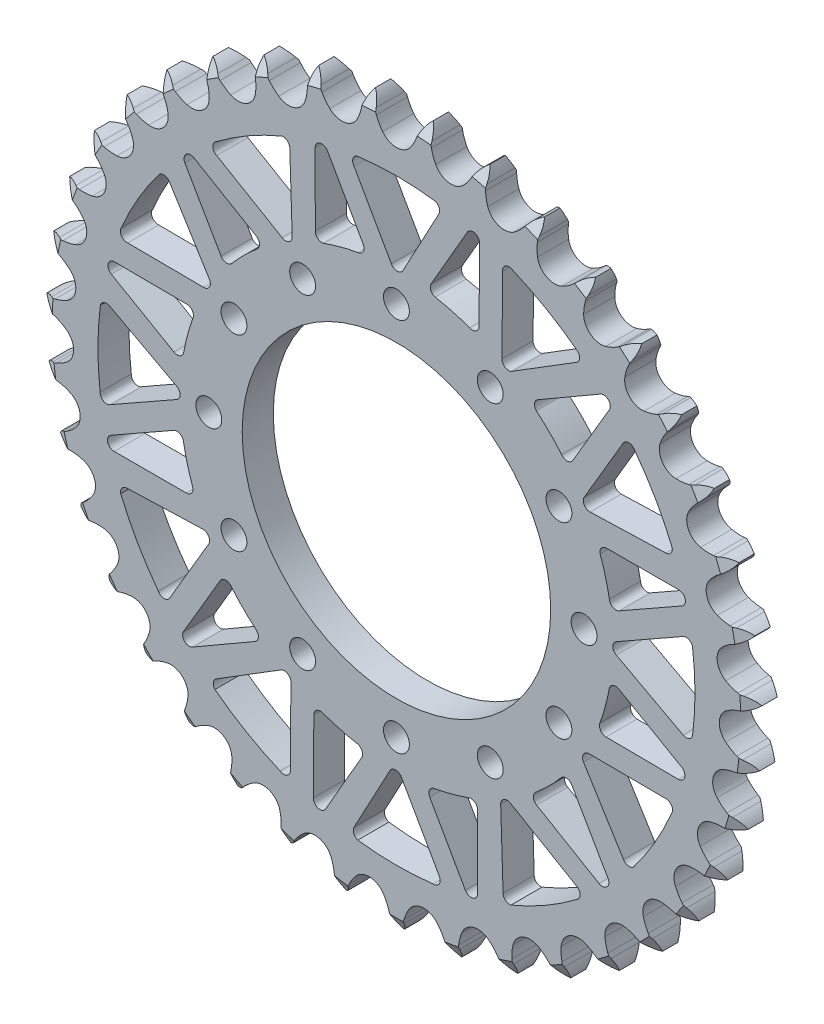
from build123d import *

# Parameters (mm, degrees)
EXTRUSION_DEPTH        = 7.2136
CUT_EXTRUDE_DEPTH      = 118.514389318
CUT_EXTRUDE_DEPTH_BACK = 118.514389318
SKETCH1_R              = 35.764294032
F_6_0MM_DOWEL_HOLE1_D  = 6
CIRPATTERN1_COUNT      = 12
CUT_EXTRUDE1_DEPTH     = 118.514389465
CIRPATTERN2_COUNT      = 12


with BuildPart() as part:
    # Teeth Sketch → Extrusion (new body)
    with BuildSketch(Plane.XY):
        with BuildLine():
            ThreePointArc((6.676484762, 82.703103732), (5.710873677, 81.555589606), (5.037571935, 80.215493266))
            Line((5.037571935, 80.215493266), (4.65053543, 79.150636707))
            ThreePointArc((4.65053543, 79.150636707), (4.030589042, 77.787636082), (3.22092759, 76.5280518))
            ThreePointArc((3.22092759, 76.5280518), (0, 74.905926143), (-3.22092759, 76.5280518))
            ThreePointArc((-3.22092759, 76.5280518), (-4.030589042, 77.787636082), (-4.65053543, 79.150636707))
            Line((-4.65053543, 79.150636707), (-5.037571935, 80.215493266))
            ThreePointArc((-5.037571935, 80.215493266), (-5.710873677, 81.555589606), (-6.676484762, 82.703103732))
            ThreePointArc((-6.676484762, 82.703103732), (-7.445517227, 81.415554702), (-7.895133318, 79.984807062))
            Line((-7.895133318, 79.984807062), (-8.106342797, 78.871655094))
            ThreePointArc((-8.106342797, 78.871655094), (-8.499620367, 77.426858575), (-9.096745387, 76.053706749))
            ThreePointArc((-9.096745387, 76.053706749), (-12.015755556, 73.935914073), (-15.455180235, 75.020360508))
            ThreePointArc((-15.455180235, 75.020360508), (-16.456408311, 76.133754674), (-17.286967233, 77.379658404))
            Line((-17.286967233, 77.379658404), (-17.83980672, 78.368640329))
            ThreePointArc((-17.83980672, 78.368640329), (-18.719355953, 79.583377579), (-19.856536839, 80.561136787))
            ThreePointArc((-19.856536839, 80.561136787), (-20.409073146, 79.166899696), (-20.623358765, 77.682556369))
            Line((-20.623358765, 77.682556369), (-20.653271004, 76.549939044))
            ThreePointArc((-20.653271004, 76.549939044), (-20.809694072, 75.060766102), (-21.178817437, 73.609610642))
            ThreePointArc((-21.178817437, 73.609610642), (-23.720309356, 71.051000665), (-27.289151829, 71.569681286))
            ThreePointArc((-27.289151829, 71.569681286), (-28.456015249, 72.508049011), (-29.475675664, 73.604587595))
            Line((-29.475675664, 73.604587595), (-30.179999883, 74.492080773))
            ThreePointArc((-30.179999883, 74.492080773), (-31.243016742, 75.549997876), (-32.522315041, 76.332678717))
            ThreePointArc((-32.522315041, 76.332678717), (-32.844044791, 74.867863573), (-32.817450053, 73.368368272))
            Line((-32.817450053, 73.368368272), (-32.66529034, 72.245619783))
            ThreePointArc((-32.66529034, 72.245619783), (-32.580807632, 70.750639215), (-32.71236924, 69.259064285))
            ThreePointArc((-32.71236924, 69.259064285), (-34.810519602, 66.325903661), (-38.416348726, 66.265384911))
            ThreePointArc((-38.416348726, 66.265384911), (-39.71862634, 67.004422965), (-40.900979579, 67.923196629))
            Line((-40.900979579, 67.923196629), (-41.738546902, 68.686215454))
            ThreePointArc((-41.738546902, 68.686215454), (-42.957499809, 69.559912912), (-44.345782367, 70.127244363))
            ThreePointArc((-44.345782367, 70.127244363), (-44.428372928, 68.629789109), (-44.161586623, 67.153977974))
            Line((-44.161586623, 67.153977974), (-43.831295815, 66.070176918))
            ThreePointArc((-43.831295815, 66.070176918), (-43.508095388, 64.608107935), (-43.398687863, 63.114744543))
            ThreePointArc((-43.398687863, 63.114744543), (-44.999155676, 59.883000591), (-48.54858237, 59.244849876))
            ThreePointArc((-48.54858237, 59.244849876), (-49.952545871, 59.765417561), (-51.266969607, 60.48263055))
            Line((-51.266969607, 60.48263055), (-52.21608748, 61.101413234))
            ThreePointArc((-52.21608748, 61.101413234), (-53.559406195, 61.768262742), (-55.020717224, 62.105551216))
            ThreePointArc((-55.020717224, 62.105551216), (-54.862029543, 60.614239157), (-54.361961296, 59.200334922))
            Line((-54.361961296, 59.200334922), (-53.862093752, 58.183551176))
            ThreePointArc((-53.862093752, 58.183551176), (-53.308546327, 56.792260597), (-52.961003266, 55.335786069))
            ThreePointArc((-52.961003266, 55.335786069), (-54.022337255, 51.889159262), (-57.423433231, 50.689904348))
            ThreePointArc((-57.423433231, 50.689904348), (-58.892720703, 50.978519235), (-60.305172051, 51.475596109))
            Line((-60.305172051, 51.475596109), (-61.34125882, 51.934116506))
            ThreePointArc((-61.34125882, 51.934116506), (-62.774152094, 52.376847013), (-64.270644405, 52.475356916))
            ThreePointArc((-64.270644405, 52.475356916), (-63.87478841, 51.02881225), (-63.154389727, 49.713434291))
            Line((-63.154389727, 49.713434291), (-62.497891753, 48.790002021))
            ThreePointArc((-62.497891753, 48.790002021), (-61.728333918, 47.505523541), (-61.151656504, 46.123659804))
            ThreePointArc((-61.151656504, 46.123659804), (-61.646368676, 42.551415963), (-64.811047336, 40.822116924))
            ThreePointArc((-64.811047336, 40.822116924), (-66.307605004, 40.871304038), (-67.781502216, 41.135370767))
            Line((-67.781502216, 41.135370767), (-68.877723777, 41.42175344))
            ThreePointArc((-68.877723777, 41.42175344), (-70.363080428, 41.628898458), (-71.855995657, 41.486078435))
            ThreePointArc((-71.855995657, 41.486078435), (-71.23322381, 40.12176591), (-70.311152637, 38.938981826))
            Line((-70.311152637, 38.938981826), (-69.515027187, 38.132817442))
            ThreePointArc((-69.515027187, 38.132817442), (-68.549390085, 36.988418379), (-67.75851396, 35.716954977))
            ThreePointArc((-67.75851396, 35.716954977), (-67.673791529, 32.111613343), (-70.520089358, 29.897058114))
            ThreePointArc((-70.520089358, 29.897058114), (-72.005157166, 29.705543536), (-73.502327078, 29.729760931))
            Line((-73.502327078, 29.729760931), (-74.630291869, 29.836588719))
            ThreePointArc((-74.630291869, 29.836588719), (-76.129641939, 29.8027833), (-77.580314364, 29.422332315))
            ThreePointArc((-77.580314364, 29.422332315), (-76.74675613, 28.175586908), (-75.646893627, 27.156030185))
            Line((-75.646893627, 27.156030185), (-74.731759931, 26.488012922))
            ThreePointArc((-74.731759931, 26.488012922), (-73.595053056, 25.51333261), (-72.610461496, 24.385199777))
            ThreePointArc((-72.610461496, 24.385199777), (-71.948498729, 20.840136804), (-74.402698108, 18.197681204))
            ThreePointArc((-74.402698108, 18.197681204), (-75.837813579, 17.77042506), (-77.319480277, 17.554165902))
            Line((-77.319480277, 17.554165902), (-78.449974603, 17.478672021))
            ThreePointArc((-78.449974603, 17.478672021), (-79.924485713, 17.204791709), (-81.295343681, 16.596563242))
            ThreePointArc((-81.295343681, 16.596563242), (-80.27258778, 15.499675005), (-79.023419807, 14.669751627))
            Line((-79.023419807, 14.669751627), (-78.012979347, 14.15718278))
            ThreePointArc((-78.012979347, 14.15718278), (-76.734642811, 13.377464928), (-75.58183622, 12.421880712))
            ThreePointArc((-75.58183622, 12.421880712), (-74.359777605, 9.028911669), (-76.358316059, 6.026993909))
            ThreePointArc((-76.358316059, 6.026993909), (-77.706310456, 5.375061909), (-79.134099551, 4.923927198))
            Line((-79.134099551, 4.923927198), (-80.237844202, 4.6680669))
            ThreePointArc((-80.237844202, 4.6680669), (-81.649327289, 4.161205049), (-82.904866299, 3.340951899))
            ThreePointArc((-82.904866299, 3.340951899), (-81.719401571, 2.422329661), (-80.353280924, 1.803534207))
            Line((-80.353280924, 1.803534207), (-79.273703577, 1.45968904))
            ThreePointArc((-79.273703577, 1.45968904), (-77.886845624, 0.895127931), (-76.595681088, 0.136841462))
            ThreePointArc((-76.595681088, 0.136841462), (-74.8451773, -3.016157536), (-76.336293733, -6.299789363))
            ThreePointArc((-76.336293733, -6.299789363), (-77.56225471, -7.159512522), (-78.899187214, -7.833838635))
            Line((-78.899187214, -7.833838635), (-79.947595784, -8.263438702))
            ThreePointArc((-79.947595784, -8.263438702), (-81.259494176, -8.990154635), (-82.367196428, -10.001188343))
            ThreePointArc((-82.367196428, -10.001188343), (-81.049725787, -10.717752749), (-79.602034272, -11.109393802))
            Line((-79.602034272, -11.109393802), (-78.481280524, -11.275609878))
            ThreePointArc((-78.481280524, -11.275609878), (-77.021820047, -11.610392409), (-75.625738049, -12.151741911))
            ThreePointArc((-75.625738049, -12.151741911), (-73.392126218, -14.983109845), (-74.337201497, -18.463411399))
            ThreePointArc((-74.337201497, -18.463411399), (-75.409377308, -19.50865934), (-76.620827372, -20.388712162))
            Line((-76.620827372, -20.388712162), (-77.586746629, -20.980925582))
            ThreePointArc((-77.586746629, -20.980925582), (-78.765082849, -21.908674036), (-79.696259435, -23.08430306))
            ThreePointArc((-79.696259435, -23.08430306), (-78.280904679, -23.580250992), (-76.789136745, -23.734594346))
            Line((-76.789136745, -23.734594346), (-75.656233531, -23.718876424))
            ThreePointArc((-75.656233531, -23.718876424), (-74.161969788, -23.815209685), (-72.697128119, -24.125601551))
            ThreePointArc((-72.697128119, -24.125601551), (-70.038257617, -26.562007479), (-70.41281479, -30.148840778))
            ThreePointArc((-70.41281479, -30.148840778), (-71.303436645, -31.352542128), (-72.358028349, -32.415528753))
            Line((-72.358028349, -32.415528753), (-73.216441492, -33.155017511))
            ThreePointArc((-73.216441492, -33.155017511), (-74.230697248, -34.259770288), (-74.961231185, -35.569546454))
            ThreePointArc((-74.961231185, -35.569546454), (-73.484649258, -35.832033121), (-71.987440912, -35.745081364))
            Line((-71.987440912, -35.745081364), (-70.871729829, -35.547836529))
            ThreePointArc((-70.871729829, -35.547836529), (-69.381363468, -35.403225539), (-67.885700756, -35.474620783))
            ThreePointArc((-67.885700756, -35.474620783), (-64.870434934, -37.452963072), (-64.664773166, -41.053431017))
            ThreePointArc((-64.664773166, -41.053431017), (-65.350774426, -42.384410543), (-66.221194398, -43.602800177))
            Line((-66.221194398, -43.602800177), (-66.949868978, -44.470411902))
            ThreePointArc((-66.949868978, -44.470411902), (-67.773775581, -45.723556485), (-68.284746423, -47.133557278))
            ThreePointArc((-68.284746423, -47.133557278), (-66.785180021, -47.155784414), (-65.321308173, -46.829789551))
            Line((-65.321308173, -46.829789551), (-64.251685552, -46.456126341))
            ThreePointArc((-64.251685552, -46.456126341), (-62.803816278, -46.074316448), (-61.316069403, -45.904865971))
            ThreePointArc((-61.316069403, -45.904865971), (-58.022502061, -47.373906594), (-57.241947884, -50.894758957))
            ThreePointArc((-57.241947884, -50.894758957), (-57.705561477, -52.318544989), (-58.369266298, -53.66078198))
            Line((-58.369266298, -53.66078198), (-58.949330025, -54.634045983))
            ThreePointArc((-58.949330025, -54.634045983), (-59.561548726, -56.003126587), (-59.839722596, -57.476833727))
            ThreePointArc((-59.839722596, -57.476833727), (-58.356009703, -57.25822566), (-56.963387864, -56.701630787))
            Line((-56.963387864, -56.701630787), (-55.967556369, -56.161226883))
            ThreePointArc((-55.967556369, -56.161226883), (-54.599683236, -55.552106762), (-53.15838406, -55.146199243))
            ThreePointArc((-53.15838406, -55.146199243), (-49.671816862, -56.06789082), (-48.336586219, -59.417939375))
            ThreePointArc((-48.336586219, -59.417939375), (-48.565804798, -60.897656602), (-49.00560486, -62.328977716))
            Line((-49.00560486, -62.328977716), (-49.422034389, -63.382686971))
            ThreePointArc((-49.422034389, -63.382686971), (-49.806709045, -64.832245127), (-49.844881387, -66.331490374))
            ThreePointArc((-49.844881387, -66.331490374), (-48.415449386, -65.877708938), (-47.130145731, -65.104929569))
            Line((-47.130145731, -65.104929569), (-46.233896874, -64.411781148))
            ThreePointArc((-46.233896874, -64.411781148), (-44.981447078, -63.591126692), (-43.623924493, -62.959274922))
            ThreePointArc((-43.623924493, -62.959274922), (-40.034657698, -63.309746125), (-38.179332362, -66.402226373))
            ThreePointArc((-38.179332362, -66.402226373), (-38.168219284, -67.899550896), (-38.372723998, -69.38288567))
            Line((-38.372723998, -69.38288567), (-38.614734022, -70.489749661))
            ThreePointArc((-38.614734022, -70.489749661), (-38.761901763, -71.982242573), (-38.559083932, -73.468196262))
            ThreePointArc((-38.559083932, -73.468196262), (-37.220954361, -72.790994159), (-36.076257579, -71.822044874))
            Line((-36.076257579, -71.822044874), (-35.302803736, -70.994104116))
            ThreePointArc((-35.302803736, -70.994104116), (-34.198215068, -69.983169844), (-32.959628196, -69.141738451))
            ThreePointArc((-32.959628196, -69.141738451), (-29.360621929, -68.91191226), (-27.033253851, -71.666730588))
            ThreePointArc((-27.033253851, -71.666730588), (-26.78209694, -73.142882488), (-26.74600974, -74.639813329))
            Line((-26.74600974, -74.639813329), (-26.807332328, -75.77116486))
            ThreePointArc((-26.807332328, -75.77116486), (-26.713181585, -77.267937748), (-26.274626458, -78.702114459))
            ThreePointArc((-26.274626458, -78.702114459), (-25.06245617, -77.819030866), (-24.088013307, -76.679006943))
            Line((-24.088013307, -76.679006943), (-23.457386525, -75.737717079))
            ThreePointArc((-23.457386525, -75.737717079), (-22.529267252, -74.562685657), (-21.441694841, -73.533467273))
            ThreePointArc((-21.441694841, -73.533467273), (-17.926161474, -72.729296065), (-15.187028265, -75.075104125))
            ThreePointArc((-15.187028265, -75.075104125), (-14.702332353, -76.491851845), (-14.426587879, -77.96360903))
            Line((-14.426587879, -77.96360903), (-14.305634807, -79.090146691))
            ThreePointArc((-14.305634807, -79.090146691), (-13.972604036, -80.552433921), (-13.309669959, -81.897689231))
            ThreePointArc((-13.309669959, -81.897689231), (-12.254853529, -80.83159555), (-11.475902142, -79.55002301))
            Line((-11.475902142, -79.55002301), (-11.004435324, -78.519762952))
            ThreePointArc((-11.004435324, -78.519762952), (-10.276823247, -77.211067077), (-9.368432854, -76.020717918))
            ThreePointArc((-9.368432854, -76.020717918), (-6.027422853, -74.663029306), (-2.947466624, -76.5390719))
            ThreePointArc((-2.947466624, -76.5390719), (-2.241785081, -77.859722417), (-1.733524971, -79.26818821))
            Line((-1.733524971, -79.26818821), (-1.43342886, -80.360735266))
            ThreePointArc((-1.43342886, -80.360735266), (-0.870143382, -81.750664368), (0, -82.97215687))
            ThreePointArc((0, -82.97215687), (0.870143382, -81.750664368), (1.43342886, -80.360735266))
            Line((1.43342886, -80.360735266), (1.733524971, -79.26818821))
            ThreePointArc((1.733524971, -79.26818821), (2.241785081, -77.859722417), (2.947466624, -76.5390719))
            ThreePointArc((2.947466624, -76.5390719), (6.027422853, -74.663029306), (9.368432854, -76.020717918))
            ThreePointArc((9.368432854, -76.020717918), (10.276823247, -77.211067077), (11.004435324, -78.519762952))
            Line((11.004435324, -78.519762952), (11.475902142, -79.55002301))
            ThreePointArc((11.475902142, -79.55002301), (12.254853529, -80.83159555), (13.309669959, -81.897689231))
            ThreePointArc((13.309669959, -81.897689231), (13.972604036, -80.552433921), (14.305634807, -79.090146691))
            Line((14.305634807, -79.090146691), (14.426587879, -77.96360903))
            ThreePointArc((14.426587879, -77.96360903), (14.702332353, -76.491851845), (15.187028265, -75.075104125))
            ThreePointArc((15.187028265, -75.075104125), (17.926161474, -72.729296065), (21.441694841, -73.533467273))
            ThreePointArc((21.441694841, -73.533467273), (22.529267252, -74.562685657), (23.457386525, -75.737717079))
            Line((23.457386525, -75.737717079), (24.088013307, -76.679006943))
            ThreePointArc((24.088013307, -76.679006943), (25.06245617, -77.819030866), (26.274626458, -78.702114459))
            ThreePointArc((26.274626458, -78.702114459), (26.713181585, -77.267937748), (26.807332328, -75.77116486))
            Line((26.807332328, -75.77116486), (26.74600974, -74.639813329))
            ThreePointArc((26.74600974, -74.639813329), (26.78209694, -73.142882488), (27.033253851, -71.666730588))
            ThreePointArc((27.033253851, -71.666730588), (29.360621929, -68.91191226), (32.959628196, -69.141738451))
            ThreePointArc((32.959628196, -69.141738451), (34.198215068, -69.983169844), (35.302803736, -70.994104116))
            Line((35.302803736, -70.994104116), (36.076257579, -71.822044874))
            ThreePointArc((36.076257579, -71.822044874), (37.220954361, -72.790994159), (38.559083932, -73.468196262))
            ThreePointArc((38.559083932, -73.468196262), (38.761901763, -71.982242573), (38.614734022, -70.489749661))
            Line((38.614734022, -70.489749661), (38.372723998, -69.38288567))
            ThreePointArc((38.372723998, -69.38288567), (38.168219284, -67.899550896), (38.179332362, -66.402226373))
            ThreePointArc((38.179332362, -66.402226373), (40.034657698, -63.309746125), (43.623924493, -62.959274922))
            ThreePointArc((43.623924493, -62.959274922), (44.981447078, -63.591126692), (46.233896874, -64.411781148))
            Line((46.233896874, -64.411781148), (47.130145731, -65.104929569))
            ThreePointArc((47.130145731, -65.104929569), (48.415449386, -65.877708938), (49.844881387, -66.331490374))
            ThreePointArc((49.844881387, -66.331490374), (49.806709045, -64.832245127), (49.422034389, -63.382686971))
            Line((49.422034389, -63.382686971), (49.00560486, -62.328977716))
            ThreePointArc((49.00560486, -62.328977716), (48.565804798, -60.897656602), (48.336586219, -59.417939375))
            ThreePointArc((48.336586219, -59.417939375), (49.671816862, -56.06789082), (53.15838406, -55.146199243))
            ThreePointArc((53.15838406, -55.146199243), (54.599683236, -55.552106762), (55.967556369, -56.161226883))
            Line((55.967556369, -56.161226883), (56.963387864, -56.701630787))
            ThreePointArc((56.963387864, -56.701630787), (58.356009703, -57.25822566), (59.839722596, -57.476833727))
            ThreePointArc((59.839722596, -57.476833727), (59.561548726, -56.003126587), (58.949330025, -54.634045983))
            Line((58.949330025, -54.634045983), (58.369266298, -53.66078198))
            ThreePointArc((58.369266298, -53.66078198), (57.705561477, -52.318544989), (57.241947884, -50.894758957))
            ThreePointArc((57.241947884, -50.894758957), (58.022502061, -47.373906594), (61.316069403, -45.904865971))
            ThreePointArc((61.316069403, -45.904865971), (62.803816278, -46.074316448), (64.251685552, -46.456126341))
            Line((64.251685552, -46.456126341), (65.321308173, -46.829789551))
            ThreePointArc((65.321308173, -46.829789551), (66.785180021, -47.155784414), (68.284746423, -47.133557278))
            ThreePointArc((68.284746423, -47.133557278), (67.773775581, -45.723556485), (66.949868978, -44.470411902))
            Line((66.949868978, -44.470411902), (66.221194398, -43.602800177))
            ThreePointArc((66.221194398, -43.602800177), (65.350774426, -42.384410543), (64.664773166, -41.053431017))
            ThreePointArc((64.664773166, -41.053431017), (64.870434934, -37.452963072), (67.885700756, -35.474620783))
            ThreePointArc((67.885700756, -35.474620783), (69.381363468, -35.403225539), (70.871729829, -35.547836529))
            Line((70.871729829, -35.547836529), (71.987440912, -35.745081364))
            ThreePointArc((71.987440912, -35.745081364), (73.484649258, -35.832033121), (74.961231185, -35.569546454))
            ThreePointArc((74.961231185, -35.569546454), (74.230697248, -34.259770288), (73.216441492, -33.155017511))
            Line((73.216441492, -33.155017511), (72.358028349, -32.415528753))
            ThreePointArc((72.358028349, -32.415528753), (71.303436645, -31.352542128), (70.41281479, -30.148840778))
            ThreePointArc((70.41281479, -30.148840778), (70.038257617, -26.562007479), (72.697128119, -24.125601551))
            ThreePointArc((72.697128119, -24.125601551), (74.161969788, -23.815209685), (75.656233531, -23.718876424))
            Line((75.656233531, -23.718876424), (76.789136745, -23.734594346))
            ThreePointArc((76.789136745, -23.734594346), (78.280904679, -23.580250992), (79.696259435, -23.08430306))
            ThreePointArc((79.696259435, -23.08430306), (78.765082849, -21.908674036), (77.586746629, -20.980925582))
            Line((77.586746629, -20.980925582), (76.620827372, -20.388712162))
            ThreePointArc((76.620827372, -20.388712162), (75.409377308, -19.50865934), (74.337201497, -18.463411399))
            ThreePointArc((74.337201497, -18.463411399), (73.392126218, -14.983109845), (75.625738049, -12.151741911))
            ThreePointArc((75.625738049, -12.151741911), (77.021820047, -11.610392409), (78.481280524, -11.275609878))
            Line((78.481280524, -11.275609878), (79.602034272, -11.109393802))
            ThreePointArc((79.602034272, -11.109393802), (81.049725787, -10.717752749), (82.367196428, -10.001188343))
            ThreePointArc((82.367196428, -10.001188343), (81.259494176, -8.990154635), (79.947595784, -8.263438702))
            Line((79.947595784, -8.263438702), (78.899187214, -7.833838635))
            ThreePointArc((78.899187214, -7.833838635), (77.56225471, -7.159512522), (76.336293733, -6.299789363))
            ThreePointArc((76.336293733, -6.299789363), (74.8451773, -3.016157536), (76.595681088, 0.136841462))
            ThreePointArc((76.595681088, 0.136841462), (77.886845624, 0.895127931), (79.273703577, 1.45968904))
            Line((79.273703577, 1.45968904), (80.353280924, 1.803534207))
            ThreePointArc((80.353280924, 1.803534207), (81.719401571, 2.422329661), (82.904866299, 3.340951899))
            ThreePointArc((82.904866299, 3.340951899), (81.649327289, 4.161205049), (80.237844202, 4.6680669))
            Line((80.237844202, 4.6680669), (79.134099551, 4.923927198))
            ThreePointArc((79.134099551, 4.923927198), (77.706310456, 5.375061909), (76.358316059, 6.026993909))
            ThreePointArc((76.358316059, 6.026993909), (74.359777605, 9.028911669), (75.58183622, 12.421880712))
            ThreePointArc((75.58183622, 12.421880712), (76.734642811, 13.377464928), (78.012979347, 14.15718278))
            Line((78.012979347, 14.15718278), (79.023419807, 14.669751627))
            ThreePointArc((79.023419807, 14.669751627), (80.27258778, 15.499675005), (81.295343681, 16.596563242))
            ThreePointArc((81.295343681, 16.596563242), (79.924485713, 17.204791709), (78.449974603, 17.478672021))
            Line((78.449974603, 17.478672021), (77.319480277, 17.554165902))
            ThreePointArc((77.319480277, 17.554165902), (75.837813579, 17.77042506), (74.402698108, 18.197681204))
            ThreePointArc((74.402698108, 18.197681204), (71.948498729, 20.840136804), (72.610461496, 24.385199777))
            ThreePointArc((72.610461496, 24.385199777), (73.595053056, 25.51333261), (74.731759931, 26.488012922))
            Line((74.731759931, 26.488012922), (75.646893627, 27.156030185))
            ThreePointArc((75.646893627, 27.156030185), (76.74675613, 28.175586908), (77.580314364, 29.422332315))
            ThreePointArc((77.580314364, 29.422332315), (76.129641939, 29.8027833), (74.630291869, 29.836588719))
            Line((74.630291869, 29.836588719), (73.502327078, 29.729760931))
            ThreePointArc((73.502327078, 29.729760931), (72.005157166, 29.705543536), (70.520089358, 29.897058114))
            ThreePointArc((70.520089358, 29.897058114), (67.673791529, 32.111613343), (67.75851396, 35.716954977))
            ThreePointArc((67.75851396, 35.716954977), (68.549390085, 36.988418379), (69.515027187, 38.132817442))
            Line((69.515027187, 38.132817442), (70.311152637, 38.938981826))
            ThreePointArc((70.311152637, 38.938981826), (71.23322381, 40.12176591), (71.855995657, 41.486078435))
            ThreePointArc((71.855995657, 41.486078435), (70.363080428, 41.628898458), (68.877723777, 41.42175344))
            Line((68.877723777, 41.42175344), (67.781502216, 41.135370767))
            ThreePointArc((67.781502216, 41.135370767), (66.307605004, 40.871304038), (64.811047336, 40.822116924))
            ThreePointArc((64.811047336, 40.822116924), (61.646368676, 42.551415963), (61.151656504, 46.123659804))
            ThreePointArc((61.151656504, 46.123659804), (61.728333918, 47.505523541), (62.497891753, 48.790002021))
            Line((62.497891753, 48.790002021), (63.154389727, 49.713434291))
            ThreePointArc((63.154389727, 49.713434291), (63.87478841, 51.02881225), (64.270644405, 52.475356916))
            ThreePointArc((64.270644405, 52.475356916), (62.774152094, 52.376847013), (61.34125882, 51.934116506))
            Line((61.34125882, 51.934116506), (60.305172051, 51.475596109))
            ThreePointArc((60.305172051, 51.475596109), (58.892720703, 50.978519235), (57.423433231, 50.689904348))
            ThreePointArc((57.423433231, 50.689904348), (54.022337255, 51.889159262), (52.961003266, 55.335786069))
            ThreePointArc((52.961003266, 55.335786069), (53.308546327, 56.792260597), (53.862093752, 58.183551176))
            Line((53.862093752, 58.183551176), (54.361961296, 59.200334922))
            ThreePointArc((54.361961296, 59.200334922), (54.862029543, 60.614239157), (55.020717224, 62.105551216))
            ThreePointArc((55.020717224, 62.105551216), (53.559406195, 61.768262742), (52.21608748, 61.101413234))
            Line((52.21608748, 61.101413234), (51.266969607, 60.48263055))
            ThreePointArc((51.266969607, 60.48263055), (49.952545871, 59.765417561), (48.54858237, 59.244849876))
            ThreePointArc((48.54858237, 59.244849876), (44.999155676, 59.883000591), (43.398687863, 63.114744543))
            ThreePointArc((43.398687863, 63.114744543), (43.508095388, 64.608107935), (43.831295815, 66.070176918))
            Line((43.831295815, 66.070176918), (44.161586623, 67.153977974))
            ThreePointArc((44.161586623, 67.153977974), (44.428372928, 68.629789109), (44.345782367, 70.127244363))
            ThreePointArc((44.345782367, 70.127244363), (42.957499809, 69.559912912), (41.738546902, 68.686215454))
            Line((41.738546902, 68.686215454), (40.900979579, 67.923196629))
            ThreePointArc((40.900979579, 67.923196629), (39.71862634, 67.004422965), (38.416348726, 66.265384911))
            ThreePointArc((38.416348726, 66.265384911), (34.810519602, 66.325903661), (32.71236924, 69.259064285))
            ThreePointArc((32.71236924, 69.259064285), (32.580807632, 70.750639215), (32.66529034, 72.245619783))
            Line((32.66529034, 72.245619783), (32.817450053, 73.368368272))
            ThreePointArc((32.817450053, 73.368368272), (32.844044791, 74.867863573), (32.522315041, 76.332678717))
            ThreePointArc((32.522315041, 76.332678717), (31.243016742, 75.549997876), (30.179999883, 74.492080773))
            Line((30.179999883, 74.492080773), (29.475675664, 73.604587595))
            ThreePointArc((29.475675664, 73.604587595), (28.456015249, 72.508049011), (27.289151829, 71.569681286))
            ThreePointArc((27.289151829, 71.569681286), (23.720309356, 71.051000665), (21.178817437, 73.609610642))
            ThreePointArc((21.178817437, 73.609610642), (20.809694072, 75.060766102), (20.653271004, 76.549939044))
            Line((20.653271004, 76.549939044), (20.623358765, 77.682556369))
            ThreePointArc((20.623358765, 77.682556369), (20.409073146, 79.166899696), (19.856536839, 80.561136787))
            ThreePointArc((19.856536839, 80.561136787), (18.719355953, 79.583377579), (17.83980672, 78.368640329))
            Line((17.83980672, 78.368640329), (17.286967233, 77.379658404))
            ThreePointArc((17.286967233, 77.379658404), (16.456408311, 76.133754674), (15.455180235, 75.020360508))
            ThreePointArc((15.455180235, 75.020360508), (12.015755556, 73.935914073), (9.096745387, 76.053706749))
            ThreePointArc((9.096745387, 76.053706749), (8.499620367, 77.426858575), (8.106342797, 78.871655094))
            Line((8.106342797, 78.871655094), (7.895133318, 79.984807062))
            ThreePointArc((7.895133318, 79.984807062), (7.445517227, 81.415554702), (6.676484762, 82.703103732))
        make_face()
    extrude(amount=EXTRUSION_DEPTH)

    # Sketch1 → Cut-Extrude (cut, two sides: drawn at the far end of the back side and taken through both)
    with BuildSketch(Plane(origin=(0, 0, 0), x_dir=(-1, 0, 0), z_dir=(0, 0, -1)).offset(-CUT_EXTRUDE_DEPTH_BACK)):
        Circle(SKETCH1_R)
    extrude(amount=CUT_EXTRUDE_DEPTH + CUT_EXTRUDE_DEPTH_BACK, mode=Mode.SUBTRACT)

    # Ø6.0mm Dowel Hole1 (through all)
    with Locations(Plane.XY.offset(7.2136)):
        with Locations((-43.500000122, 0)):
            f_6_0mm_dowel_hole1 = Hole(F_6_0MM_DOWEL_HOLE1_D / 2)

    # CirPattern1: Ø6.0mm Dowel Hole1 ×12 about axis
    cirpattern1_axis = Axis((0, 0, 7.2136), (0, 0, -1))
    for i in range(1, CIRPATTERN1_COUNT):
        add(f_6_0mm_dowel_hole1.rotate(cirpattern1_axis, i * 360 / CIRPATTERN1_COUNT), mode=Mode.SUBTRACT)

    # Sketch5 → Cut-Revolve1 (revolve, cut)
    with BuildSketch(Plane(origin=(0, 0, 0), x_dir=(0, 0, -1), z_dir=(1, 0, 0))):
        Polygon((-5.3848, -82.97215687), (-7.2136, -79.778574738), (-7.2136, -82.97215687), align=None)
    cut_revolve1 = revolve(axis=Axis((0, 0, 7.2136), (0, 0, -1)), mode=Mode.SUBTRACT)

    # Mirror1: Cut-Revolve1 across plane
    add(cut_revolve1.mirror(Plane.XY.offset(3.6068)), mode=Mode.SUBTRACT)

    # Sketch9 → Cut-Extrude1 (cut, symmetric)
    with BuildSketch(Plane.XY.offset(7.2136)):
        with BuildLine():
            Line((-18.819298371, 48.700421775), (-18.829824752, 65.472428261))
            ThreePointArc((-18.829824752, 65.472428261), (-17.695271856, 66.946784621), (-15.980393135, 66.225585673))
            Line((-15.980393135, 66.225585673), (-7.702229556, 51.638868424))
            ThreePointArc((-7.702229556, 51.638868424), (-7.682420742, 50.17049477), (-8.911668967, 49.367088037))
            ThreePointArc((-8.911668967, 49.367088037), (-12.965441616, 48.46054631), (-16.930315058, 47.221728654))
            ThreePointArc((-16.930315058, 47.221728654), (-18.23469364, 47.501331141), (-18.819298371, 48.700421775))
        make_face()
        with BuildLine():
            Line((9.825700211, 66.468960975), (1.518625289, 50.961326951))
            ThreePointArc((1.518625289, 50.961326951), (0.170061457, 50.156961689), (-1.173016895, 50.970453194))
            Line((-1.173016895, 50.970453194), (-9.856124015, 66.270709972))
            ThreePointArc((-9.856124015, 66.270709972), (-9.95763881, 67.911368038), (-8.509881912, 68.68986923))
            ThreePointArc((-8.509881912, 68.68986923), (0.234678012, 69.214602153), (8.975478619, 68.630583624))
            ThreePointArc((8.975478619, 68.630583624), (9.900542634, 67.746416715), (9.825700211, 66.468960975))
        make_face()
    cut_extrude1 = extrude(amount=CUT_EXTRUDE1_DEPTH, both=True, mode=Mode.SUBTRACT)

    # CirPattern2: Cut-Extrude1 ×12 about axis
    cirpattern2_axis = Axis((0, 0, 7.2136), (0, 0, -1))
    for i in range(1, CIRPATTERN2_COUNT):
        add(cut_extrude1.rotate(cirpattern2_axis, i * 360 / CIRPATTERN2_COUNT), mode=Mode.SUBTRACT)


solid = part.part
